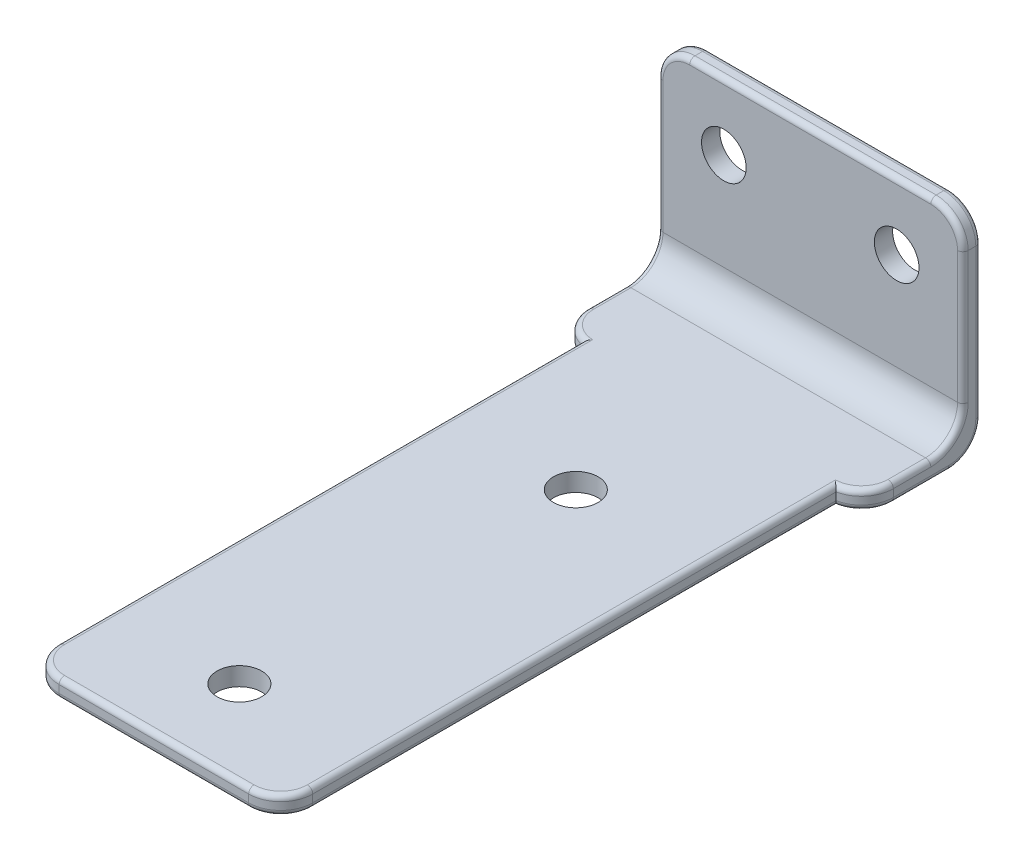
from build123d import *

# Parameters (mm, degrees)
SKETCH1_W                  = 36.2966
SKETCH1_H                  = 80.2132
BOSS_BASE_DEPTH            = 2.1717
SKETCH3_W                  = 36.2966
SKETCH3_H                  = 2.1717
BOSS_LIP_DEPTH             = 23.25116
F_4_0_209_DIAMETER_HOLE1_D = 5.3086
F_4_0_209_DIAMETER_HOLE2_D = 5.3086
SKETCH19_W                 = 3.0734
SKETCH19_H                 = 66.04
CUT_EXTRUDE1_DEPTH         = 50.784702448
FILLET1_R                  = 3.81
FILLET4_R                  = 0.635


with BuildPart() as part:
    # Sketch1 → Boss-Base (new body)
    with BuildSketch(Plane(origin=(0, 0, 0), x_dir=(1, 0, 0), z_dir=(0, 1, 0))):
        Rectangle(SKETCH1_W, SKETCH1_H)
    extrude(amount=BOSS_BASE_DEPTH)

    # Sketch3 → Boss-Lip (add)
    with BuildSketch(Plane(origin=(0, 2.1717, 0), x_dir=(1, 0, 0), z_dir=(0, 1, 0))):
        with Locations((0, 39.02075)):
            Rectangle(SKETCH3_W, SKETCH3_H)
    extrude(amount=BOSS_LIP_DEPTH)

    # #4 (0.209) Diameter Hole1 (through all)
    with Locations(Plane(origin=(0, 2.1717, 0), x_dir=(1, 0, 0), z_dir=(0, 1, 0))):
        with Locations((0, -29.9466), (0, 10.0584)):
            Hole(F_4_0_209_DIAMETER_HOLE1_D / 2)

    # #4 (0.209) Diameter Hole2 (through all)
    with Locations(Plane.XY.offset(-37.9349)):
        with Locations((10.2743, 17.54886), (-10.2743, 17.54886)):
            Hole(F_4_0_209_DIAMETER_HOLE2_D / 2)

    # Sketch19 → Cut-Extrude1 (cut, through all)
    with BuildSketch(Plane(origin=(0, 2.1717, 0), x_dir=(1, 0, 0), z_dir=(0, 1, 0))):
        with Locations((16.6116, -7.0866)):
            Rectangle(SKETCH19_W, SKETCH19_H)
        with Locations((-16.6116, -7.0866)):
            Rectangle(SKETCH19_W, SKETCH19_H)
    extrude(amount=-CUT_EXTRUDE1_DEPTH, mode=Mode.SUBTRACT)

    # Fillet1
    # the kernel refuses this fillet: 3.81 mm, written as the material it adds along each edge
    with BuildSketch(Plane(origin=(18.1483, 2.1717, -37.9349), x_dir=(0, 0, 1), z_dir=(-1, 0, 0))) as fillet1_piece_1:
        with BuildLine():
            CenterArc((FILLET1_R, FILLET1_R), FILLET1_R, 180, 90)
            Line((0, FILLET1_R), (0, 0))
            Line((0, 0), (FILLET1_R, 0))
        make_face()
    extrude(amount=36.2966)
    # the kernel refuses this fillet: 3.81 mm, written as the material it takes off along each edge
    with BuildSketch(Plane(origin=(-18.1483, 11.51699308, -25.9334), x_dir=(0, 0, -1), z_dir=(0, -1, 0))) as fillet1_2_piece_1:
        with BuildLine():
            CenterArc((3.738117232, 3.81), FILLET1_R, 191.147377986, 78.852622014)
            Line((0, 3.0734), (0, 0))
            Line((0, 0), (3.738117232, 0))
        make_face()
    extrude(amount=20.86228616, mode=Mode.SUBTRACT)
    with BuildSketch(Plane(origin=(18.1483, 11.51699308, -25.9334), x_dir=(-1, 0, 0), z_dir=(0, -1, 0))) as fillet1_2_piece_2:
        with BuildLine():
            CenterArc((3.81, 3.738117232), FILLET1_R, 180, 78.852622014)
            Line((0, 3.738117232), (0, 0))
            Line((0, 0), (3.0734, 0))
        make_face()
    extrude(amount=20.86228616, mode=Mode.SUBTRACT)
    with BuildSketch(Plane(origin=(15.0749, 11.6967, 40.1066), x_dir=(-1, 0, 0), z_dir=(0, -1, 0))) as fillet1_2_piece_3:
        with BuildLine():
            CenterArc((FILLET1_R, FILLET1_R), FILLET1_R, 180, 90)
            Line((0, FILLET1_R), (0, 0))
            Line((0, 0), (FILLET1_R, 0))
        make_face()
    extrude(amount=21.2217, mode=Mode.SUBTRACT)
    with BuildSketch(Plane(origin=(-15.0749, 11.6967, 40.1066), x_dir=(1, 0, 0), z_dir=(0, -1, 0)), Plane(origin=(-18.1483, 25.42286, -28.4099), x_dir=(0, -1, 0), z_dir=(0, 0, -1)), Plane(origin=(18.1483, 25.42286, -49.6316), x_dir=(0, -1, 0), z_dir=(0, 0, 1))) as fillet1_2_piece_4:
        with BuildLine():
            CenterArc((FILLET1_R, -FILLET1_R), FILLET1_R, 90, 90)
            Line((0, -FILLET1_R), (0, 0))
            Line((0, 0), (FILLET1_R, 0))
        make_face()
    extrude(amount=21.2217, mode=Mode.SUBTRACT)
    with BuildSketch(Plane(origin=(-27.6733, 0, -40.1066), x_dir=(0, 0, 1), z_dir=(1, 0, 0))) as fillet1_2_piece_5:
        with BuildLine():
            CenterArc((FILLET1_R, -FILLET1_R), FILLET1_R, 90, 90)
            Line((0, -FILLET1_R), (0, 0))
            Line((0, 0), (FILLET1_R, 0))
        make_face()
    extrude(amount=55.3466, mode=Mode.SUBTRACT)

    # Fillet4
    fillet4_edges = [part.edges().sort_by_distance(p)[0] for p in [
        (18.1483, 3.287623164, -36.818976836),
        (-18.1483, 3.287623164, -36.818976836),
        (15.0749, 0, 5.1816),
        (15.0749, 2.1717, 5.1816),
        (18.1483, 13.79728, -37.9349),
        (0, 25.42286, -37.9349),
        (-18.1483, 13.79728, -37.9349),
        (17.032376836, 24.306936836, -37.9349),
        (-17.032376836, 24.306936836, -37.9349),
        (18.1483, 2.1717, -31.898208616),
        (-18.1483, 2.1717, -31.898208616),
        (-15.0749, 2.1717, 5.1816),
        (0, 2.1717, 40.1066),
        (-17.281304077, 2.1717, -27.251842254),
        (17.281304077, 2.1717, -27.251842254),
        (13.958976836, 2.1717, 38.990676836),
        (-13.958976836, 2.1717, 38.990676836),
        (-18.1483, 12.71143, -40.1066),
        (0, 25.42286, -40.1066),
        (18.1483, 12.71143, -40.1066),
        (17.032376836, 24.306936836, -40.1066),
        (-17.032376836, 24.306936836, -40.1066),
        (-18.1483, 0, -32.984058616),
        (-18.1483, 1.115923164, -38.990676836),
        (0, 0, 40.1066),
        (-15.0749, 0, 5.1816),
        (18.1483, 0, -32.984058616),
        (-17.281304077, 0, -27.251842254),
        (17.281304077, 0, -27.251842254),
        (13.958976836, 0, 38.990676836),
        (-13.958976836, 0, 38.990676836),
        (18.1483, 1.115923164, -38.990676836),
    ]]
    fillet(fillet4_edges, radius=FILLET4_R)


solid = part.part
